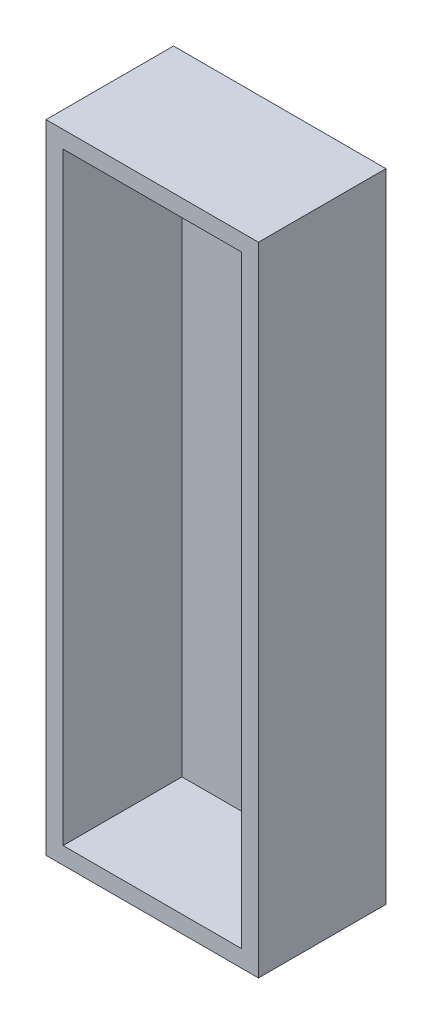
from build123d import *

# Parameters (mm, degrees)
CROQUIS1_W              = 50
CROQUIS1_H              = 150
SALIENTE_EXTRUIR1_DEPTH = 30
CROQUIS2_W              = 42
CROQUIS2_H              = 142
CORTAR_EXTRUIR1_DEPTH   = 28


with BuildPart() as part:
    # Croquis1 → Saliente-Extruir1 (new body)
    with BuildSketch(Plane.XY):
        Rectangle(CROQUIS1_W, CROQUIS1_H)
    extrude(amount=SALIENTE_EXTRUIR1_DEPTH)

    # Croquis2 → Cortar-Extruir1 (cut)
    with BuildSketch(Plane.XY.offset(30)):
        Rectangle(CROQUIS2_W, CROQUIS2_H)
    extrude(amount=-CORTAR_EXTRUIR1_DEPTH, mode=Mode.SUBTRACT)


solid = part.part
